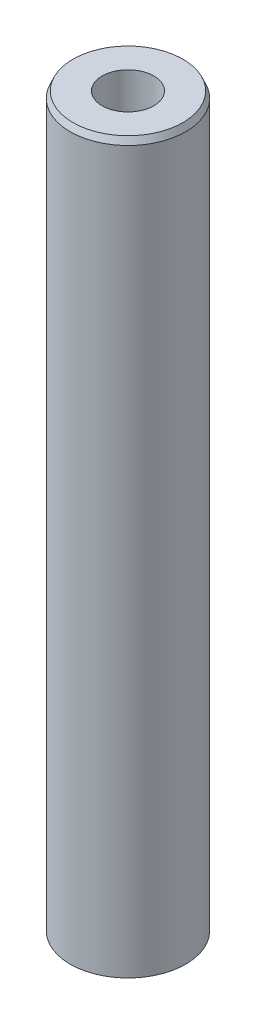
from build123d import *
from OCP.BRepFilletAPI import BRepFilletAPI_MakeChamfer

# Parameters (mm, degrees)
SKETCH1_R           = 47.5
BOSS_EXTRUDE1_DEPTH = 600
SKETCH2_R           = 21.24072319
CUT_EXTRUDE1_DEPTH  = 604.748706003
CHAMFER1_SIZE       = 5.323488717
CHAMFER1_SIZE2      = 2.341416319


with BuildPart() as part:
    # Sketch1 → Boss-Extrude1 (new body)
    with BuildSketch(Plane(origin=(0, 0, 0), x_dir=(1, 0, 0), z_dir=(0, 1, 0))):
        Circle(SKETCH1_R)
    extrude(amount=BOSS_EXTRUDE1_DEPTH)

    # Sketch2 → Cut-Extrude1 (cut, through all)
    with BuildSketch(Plane(origin=(0, 0, 0), x_dir=(1, 0, 0), z_dir=(0, 1, 0))):
        Circle(SKETCH2_R)
    extrude(amount=CUT_EXTRUDE1_DEPTH, mode=Mode.SUBTRACT)

    # Chamfer1: one chamfer whose edges measure the first distance from different faces: ONE call of the kernel's chamfer builder (chamfer() names one face for all edges)
    chamfer1_edges_1 = [part.edges().sort_by_distance(p)[0] for p in [
        (-47.5, 600, 0),
    ]]
    chamfer1_side_1 = [part.faces().sort_by_distance(p)[0] for p in [
        (-47.5, 300, 0),
    ]]
    chamfer1_edges_2 = [part.edges().sort_by_distance(p)[0] for p in [
        (-47.5, 0, 0),
    ]]
    chamfer1_side_2 = [part.faces().sort_by_distance(p)[0] for p in [
        (-46.156497116, 0, 0),
    ]]
    chamfer1 = BRepFilletAPI_MakeChamfer(part.part.solid().wrapped)
    for e in chamfer1_edges_1:
        chamfer1.Add(CHAMFER1_SIZE, CHAMFER1_SIZE2, e.wrapped, chamfer1_side_1[0].wrapped)  # the first distance lies on this face
    for e in chamfer1_edges_2:
        chamfer1.Add(CHAMFER1_SIZE, CHAMFER1_SIZE2, e.wrapped, chamfer1_side_2[0].wrapped)  # the first distance lies on this face
    add(Compound.cast(chamfer1.Shape()), mode=Mode.REPLACE)


solid = part.part
